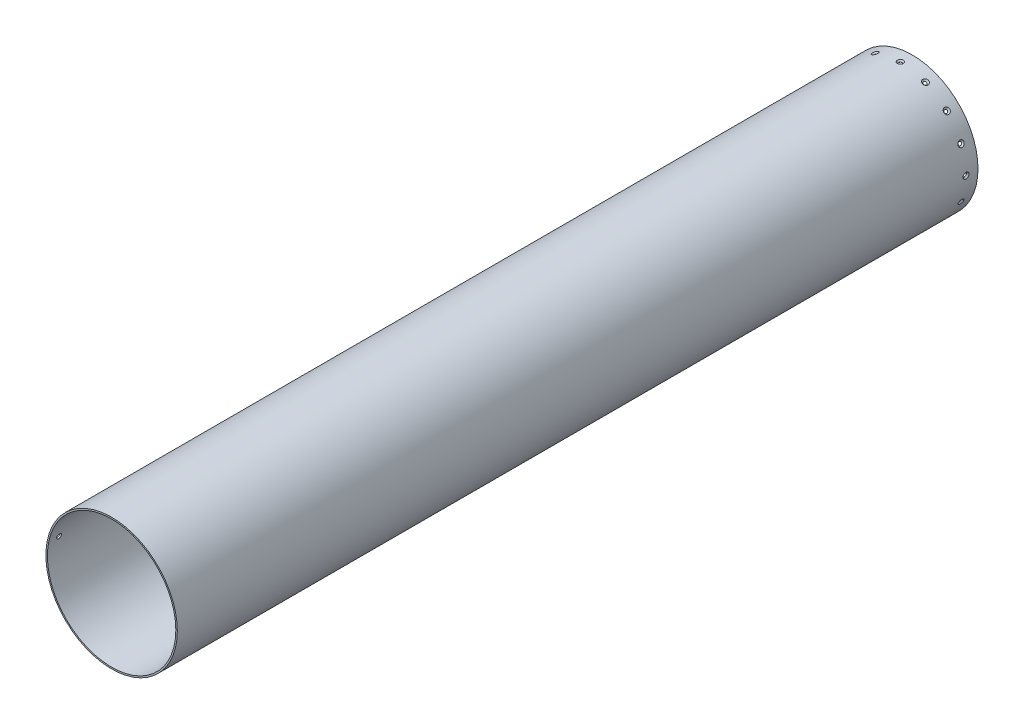
from build123d import *

# Parameters (mm, degrees)
SKETCH1_R                                       = 69.85
SKETCH1_R_2                                     = 68.2625
EXTRUDE1_DEPTH                                  = 850.9
CSK_FOR_M3_FLAT_HEAD_MACHINE_SCREW1_D           = 3.4
CSK_FOR_M3_FLAT_HEAD_MACHINE_SCREW1_CSINK_D     = 6.3
CSK_FOR_M3_FLAT_HEAD_MACHINE_SCREW1_CSINK_ANGLE = 90
CIRPATTERN1_COUNT                               = 16
F_7_0_201_DIAMETER_HOLE1_D                      = 5.1054
F_7_0_201_DIAMETER_HOLE1_DEPTH                  = 10.16
F_7_0_201_DIAMETER_HOLE1_TIP                    = 1.533816902


with BuildPart() as part:
    # Sketch1 → Extrude1 (new body)
    with BuildSketch(Plane.XY):
        Circle(SKETCH1_R)
        Circle(SKETCH1_R_2, mode=Mode.SUBTRACT)
    extrude(amount=EXTRUDE1_DEPTH)

    # CSK for M3 Flat Head Machine Screw1 (through all)
    with Locations(Plane(origin=(0, -69.85, 12.7), x_dir=(1, 0, 0), z_dir=(0, -1, 0))):
        with Locations((0, 0)):
            csk_for_m3_flat_head_machine_screw1 = CounterSinkHole(CSK_FOR_M3_FLAT_HEAD_MACHINE_SCREW1_D / 2, CSK_FOR_M3_FLAT_HEAD_MACHINE_SCREW1_CSINK_D / 2, counter_sink_angle=CSK_FOR_M3_FLAT_HEAD_MACHINE_SCREW1_CSINK_ANGLE)

    # CirPattern1: CSK for M3 Flat Head Machine Screw1 ×16 about axis
    cirpattern1_axis = Axis((0, 0, 850.9), (0, 0, -1))
    for i in range(1, CIRPATTERN1_COUNT):
        add(csk_for_m3_flat_head_machine_screw1.rotate(cirpattern1_axis, i * 360 / CIRPATTERN1_COUNT), mode=Mode.SUBTRACT)

    # #7 (0.201) Diameter Hole1
    with Locations(Plane(origin=(-68.507851836, 13.627058993, 425.45), x_dir=(0.19509032201613552, 0.9807852804032291, 0), z_dir=(-0.9807852804032291, 0.19509032201613552, 0))):
        with Locations((0, -414.3248)):
            Hole(F_7_0_201_DIAMETER_HOLE1_D / 2, depth=F_7_0_201_DIAMETER_HOLE1_DEPTH)
            with Locations((0, 0, -(F_7_0_201_DIAMETER_HOLE1_DEPTH + F_7_0_201_DIAMETER_HOLE1_TIP / 2))):  # 118° drill point
                Cone(0, F_7_0_201_DIAMETER_HOLE1_D / 2, F_7_0_201_DIAMETER_HOLE1_TIP, mode=Mode.SUBTRACT)


solid = part.part
